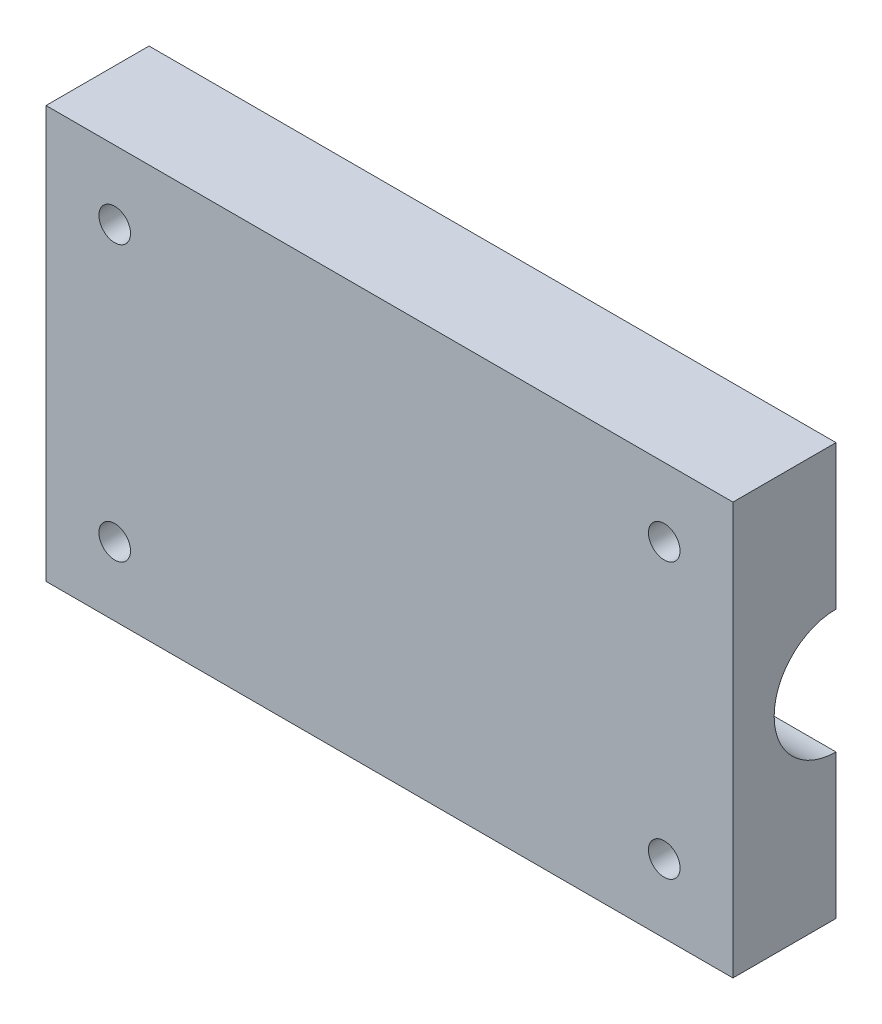
from build123d import *

# Parameters (mm, degrees)
SKETCH1_W           = 100
SKETCH1_H           = 60
SKETCH1_R           = 2.3
BOSS_EXTRUDE1_DEPTH = 15
SKETCH2_R           = 9
CUT_EXTRUDE1_DEPTH  = 200


with BuildPart() as part:
    # Sketch1 → Boss-Extrude1 (new body)
    with BuildSketch(Plane.XY):
        Rectangle(SKETCH1_W, SKETCH1_H)
        with Locations((-40, -20)):
            Circle(SKETCH1_R, mode=Mode.SUBTRACT)
        with Locations((40, -20)):
            Circle(SKETCH1_R, mode=Mode.SUBTRACT)
        with Locations((40, 20)):
            Circle(SKETCH1_R, mode=Mode.SUBTRACT)
        with Locations((-40, 20)):
            Circle(SKETCH1_R, mode=Mode.SUBTRACT)
    extrude(amount=BOSS_EXTRUDE1_DEPTH)

    # Sketch2 → Cut-Extrude1 (cut, symmetric)
    with BuildSketch(Plane.ZY.offset(50)):
        Circle(SKETCH2_R)
    extrude(amount=CUT_EXTRUDE1_DEPTH, both=True, mode=Mode.SUBTRACT)


solid = part.part
